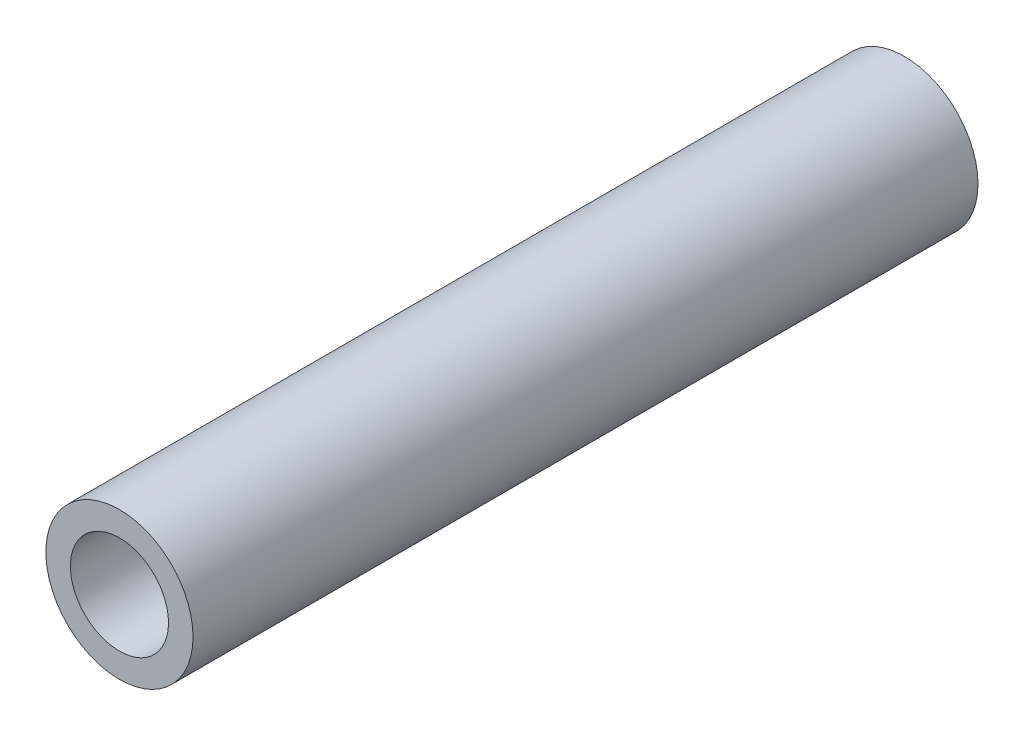
from build123d import *

# Parameters (mm, degrees)
ESQUISSE1_R        = 3
ESQUISSE1_R_2      = 2
BOSS_EXTRU_1_DEPTH = 32


with BuildPart() as part:
    # Esquisse1 → Boss.-Extru.1 (new body)
    with BuildSketch(Plane.XY):
        Circle(ESQUISSE1_R)
        Circle(ESQUISSE1_R_2, mode=Mode.SUBTRACT)
    extrude(amount=BOSS_EXTRU_1_DEPTH)


solid = part.part
